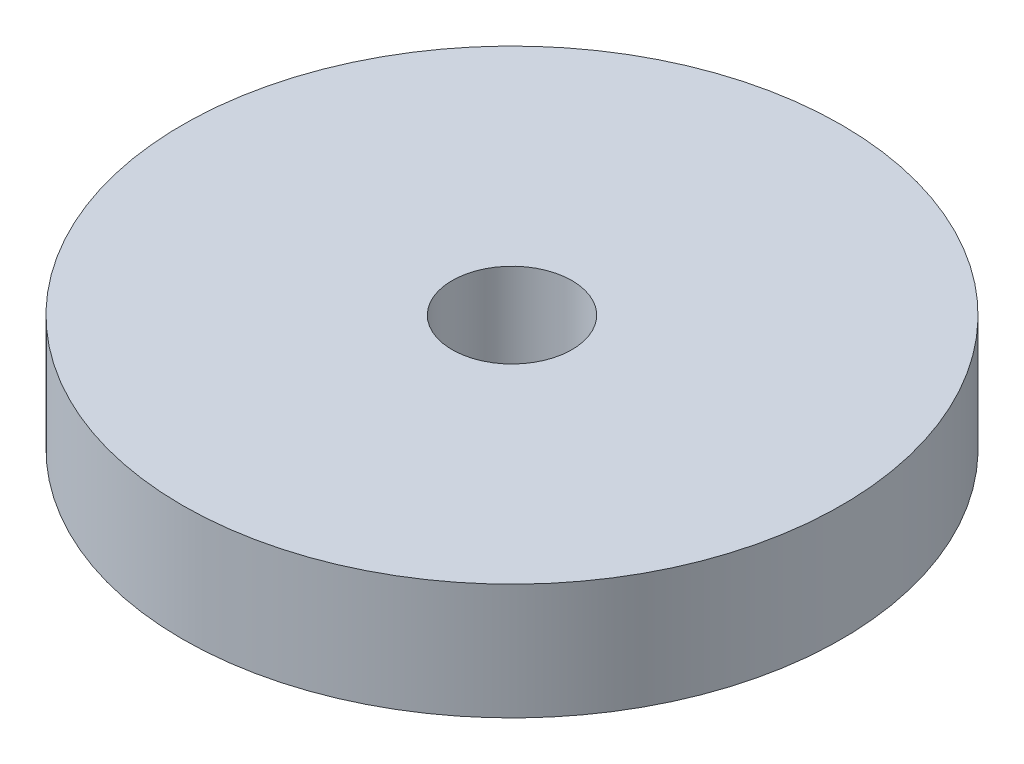
from build123d import *

# Parameters (mm, degrees)
SKETCH1_R           = 82.5
BOSS_EXTRUDE1_DEPTH = 29
SKETCH2_R           = 15
CUT_EXTRUDE1_DEPTH  = 121.222710001


with BuildPart() as part:
    # Sketch1 → Boss-Extrude1 (new body)
    with BuildSketch(Plane(origin=(0, 0, 0), x_dir=(1, 0, 0), z_dir=(0, 1, 0))):
        Circle(SKETCH1_R)
    extrude(amount=BOSS_EXTRUDE1_DEPTH)

    # Sketch2 → Cut-Extrude1 (cut, through all)
    with BuildSketch(Plane(origin=(0, 0, 0), x_dir=(1, 0, 0), z_dir=(0, 1, 0))):
        Circle(SKETCH2_R)
    extrude(amount=CUT_EXTRUDE1_DEPTH, mode=Mode.SUBTRACT)


solid = part.part
